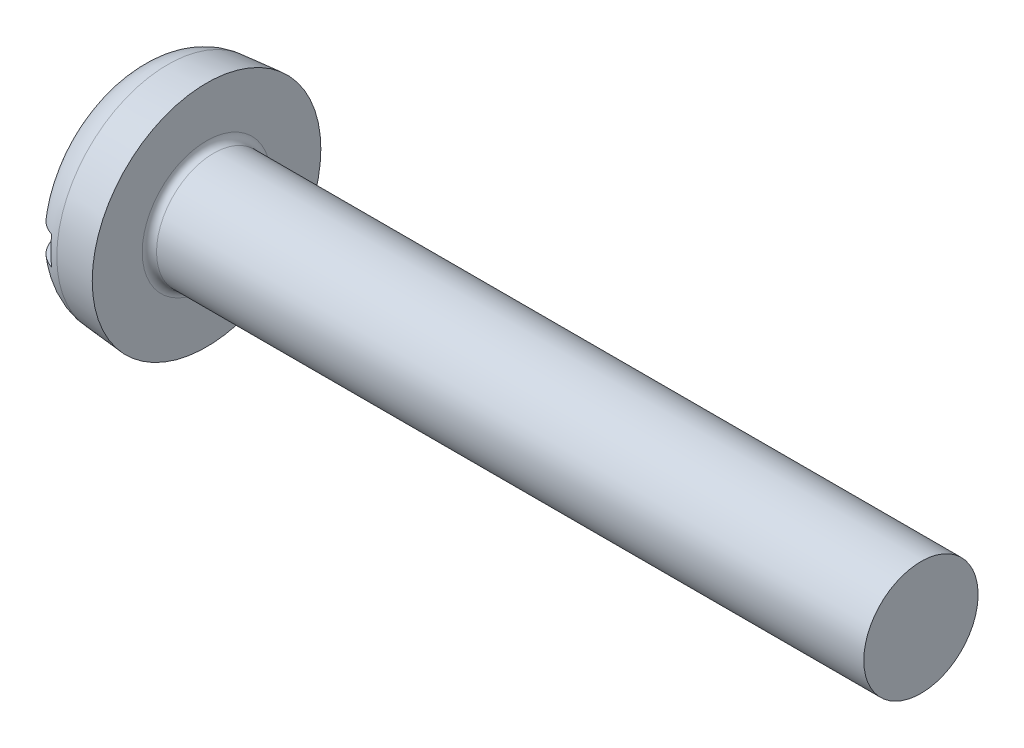
from build123d import *

# Parameters (mm, degrees)
FILLET1_R     = 0.1
HEAD_RADIUS_R = 0.5
SLOTSKE_W     = 3.2
SLOTSKE_H     = 0.4
SLOT_DEPTH    = 0.35


with BuildPart() as part:
    # BodySke → BaseBody (revolve)
    with BuildSketch(Plane.XY):
        Polygon((0, 0), (0, 1.512511336), (1, 1.6), (1, 0.8), (11, 0.8), (11, 0), align=None)
    revolve(axis=Axis((0, 0, 0), (1, 0, 0)))

    # Fillet1
    fillet1_edges = [part.edges().sort_by_distance(p)[0] for p in [
        (1, -0.8, 0),
    ]]
    fillet(fillet1_edges, radius=FILLET1_R)

    # Head_Radius
    head_radius_edges = [part.edges().sort_by_distance(p)[0] for p in [
        (0, -1.512511336, 0),
    ]]
    fillet(head_radius_edges, radius=HEAD_RADIUS_R)

    # SlotSke → Slot (cut)
    with BuildSketch(Plane(origin=(0, 0, 0), x_dir=(0, 0, -1), z_dir=(1, 0, 0))):
        Rectangle(SLOTSKE_W, SLOTSKE_H)
    extrude(amount=SLOT_DEPTH, mode=Mode.SUBTRACT)


solid = part.part
